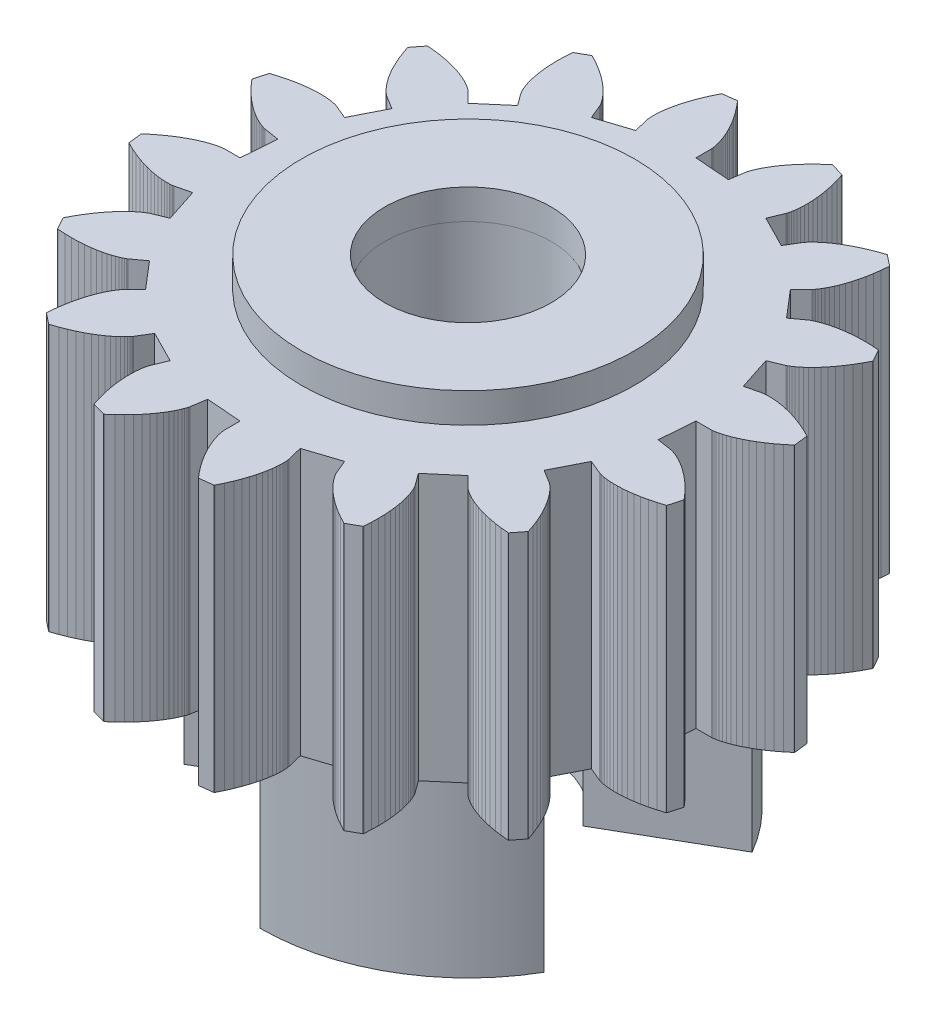
from build123d import *

# Parameters (mm, degrees)
BOSS_EXTRUDE1_DEPTH     = 8
CUT_EXTRUDE1_DEPTH      = 15.984044596
CUT_EXTRUDE1_DEPTH_BACK = 15.984044596
SKETCH2_R               = 2.525
SKETCH3_R               = 6.25
SKETCH3_R_2             = 2.525
BOSS_EXTRUDE2_DEPTH     = 5.5
SKETCH4_R               = 5
SKETCH4_R_2             = 2.5
BOSS_EXTRUDE3_DEPTH     = 0.9
CUT_EXTRUDE2_START      = -5.5
CUT_EXTRUDE2_DEPTH      = 5.5


with BuildPart() as part:
    # Sketch1 → Boss-Extrude1 (new body)
    with BuildSketch(Plane(origin=(0, 0, 0), x_dir=(1, 0, 0), z_dir=(0, 1, 0))):
        Polygon((6.85, 0), (7.309477, 1.3e-05), (7.321987, 0.000555), (7.348326, 0.002795), (7.388345, 0.007937), (7.441814, 0.017175), (7.508424, 0.03169), (7.587793, 0.052638), (7.679459, 0.081154), (7.782889, 0.118343), (7.897476, 0.165276), (8.022541, 0.222988), (8.157339, 0.29247), (8.301057, 0.37467), (8.452819, 0.470485), (8.611689, 0.580758), (8.776672, 0.706278), (8.94672, 0.847771), (8.957492, 0.857161), (8.958839, 0.858339), (8.908582, 1.279521), (8.906822, 1.280587), (8.894139, 1.28717), (8.695507, 1.384544), (8.505565, 1.467592), (8.325162, 1.537266), (8.155077, 1.594567), (7.996022, 1.640535), (7.848635, 1.676249), (7.713484, 1.702822), (7.591059, 1.721393), (7.481775, 1.733127), (7.385968, 1.739209), (7.303897, 1.740839), (7.235743, 1.739226), (7.181604, 1.735588), (7.141502, 1.731143), (7.115378, 1.727104), (7.103093, 1.724679), (6.656587, 1.616277), (6.328575, 2.621382), (6.753071, 2.797228), (6.764421, 2.802516), (6.787899, 2.814665), (6.822904, 2.83473), (6.868766, 2.863727), (6.924752, 2.902627), (6.990063, 2.952354), (7.063839, 3.013779), (7.145164, 3.087718), (7.233068, 3.174929), (7.326528, 3.276108), (7.424475, 3.391886), (7.525796, 3.522827), (7.62934, 3.669425), (7.733916, 3.832101), (7.838307, 4.011203), (7.941264, 4.207), (7.947622, 4.219797), (7.948416, 4.221401), (7.740805, 4.59129), (7.738771, 4.591601), (7.724535, 4.592829), (7.503759, 4.606779), (7.296494, 4.610817), (7.10316, 4.60615), (6.924094, 4.594), (6.759555, 4.575601), (6.609721, 4.552195), (6.474689, 4.525025), (6.354476, 4.495332), (6.249019, 4.464352), (6.158178, 4.433307), (6.081731, 4.403406), (6.019382, 4.375835), (5.970756, 4.351756), (5.935408, 4.332302), (5.912818, 4.318573), (5.902396, 4.311632), (5.531362, 4.040611), (4.843681, 4.843681), (5.168571, 5.16859), (5.177034, 5.177819), (5.194075, 5.198027), (5.218737, 5.229961), (5.250012, 5.274302), (5.28685, 5.331666), (5.328159, 5.402601), (5.372813, 5.487583), (5.419653, 5.587015), (5.467491, 5.701227), (5.515117, 5.83047), (5.561302, 5.974917), (5.604802, 6.134665), (5.644363, 6.309728), (5.678725, 6.500042), (5.70663, 6.705458), (5.726822, 6.925752), (5.727799, 6.940007), (5.727919, 6.941793), (5.394561, 7.204076), (5.392562, 7.203586), (5.37894, 7.199273), (5.169631, 7.127673), (4.976599, 7.052087), (4.799767, 6.973789), (4.638981, 6.894039), (4.494008, 6.814074), (4.364536, 6.735111), (4.25018, 6.658334), (4.150481, 6.584898), (4.064908, 6.51592), (3.992861, 6.452475), (3.933677, 6.395594), (3.886624, 6.346262), (3.850915, 6.305407), (3.825702, 6.273907), (3.810085, 6.252579), (3.803113, 6.242178), (3.564037, 5.849798), (2.621382, 6.328575), (2.797204, 6.753081), (2.80149, 6.764846), (2.809501, 6.790038), (2.820065, 6.828978), (2.831991, 6.881912), (2.844072, 6.949007), (2.855091, 7.03035), (2.863825, 7.125952), (2.869048, 7.23574), (2.869538, 7.359565), (2.864079, 7.497195), (2.851471, 7.648322), (2.830527, 7.812556), (2.800083, 7.989433), (2.759, 8.17841), (2.706171, 8.378869), (2.640523, 8.59012), (2.63597, 8.603664), (2.635398, 8.60536), (2.227044, 8.720108), (2.225385, 8.71889), (2.21445, 8.709692), (2.048474, 8.563443), (1.899061, 8.419741), (1.765653, 8.279733), (1.647625, 8.144523), (1.544288, 8.015166), (1.45489, 7.892666), (1.37862, 7.777972), (1.314613, 7.671973), (1.261951, 7.575498), (1.219668, 7.489311), (1.186755, 7.414112), (1.162163, 7.350528), (1.144806, 7.299118), (1.133567, 7.260367), (1.127301, 7.234686), (1.12484, 7.222408), (1.054121, 6.768407), (0, 6.85), (-1.3e-05, 7.309477), (-0.000555, 7.321987), (-0.002795, 7.348326), (-0.007937, 7.388345), (-0.017175, 7.441814), (-0.03169, 7.508424), (-0.052638, 7.587793), (-0.081154, 7.679459), (-0.118343, 7.782889), (-0.165276, 7.897476), (-0.222988, 8.022541), (-0.29247, 8.157339), (-0.37467, 8.301057), (-0.470485, 8.452819), (-0.580758, 8.611689), (-0.706278, 8.776672), (-0.847771, 8.94672), (-0.857161, 8.957492), (-0.858339, 8.958839), (-1.279521, 8.908582), (-1.280587, 8.906822), (-1.28717, 8.894139), (-1.384544, 8.695507), (-1.467592, 8.505565), (-1.537266, 8.325162), (-1.594567, 8.155077), (-1.640535, 7.996022), (-1.676249, 7.848635), (-1.702822, 7.713484), (-1.721393, 7.591059), (-1.733127, 7.481775), (-1.739209, 7.385968), (-1.740839, 7.303897), (-1.739226, 7.235743), (-1.735588, 7.181604), (-1.731143, 7.141502), (-1.727104, 7.115378), (-1.724679, 7.103093), (-1.616277, 6.656587), (-2.621382, 6.328575), (-2.797228, 6.753071), (-2.802516, 6.764421), (-2.814665, 6.787899), (-2.83473, 6.822904), (-2.863727, 6.868766), (-2.902627, 6.924752), (-2.952354, 6.990063), (-3.013779, 7.063839), (-3.087718, 7.145164), (-3.174929, 7.233068), (-3.276108, 7.326528), (-3.391886, 7.424475), (-3.522827, 7.525796), (-3.669425, 7.62934), (-3.832101, 7.733916), (-4.011203, 7.838307), (-4.207, 7.941264), (-4.219797, 7.947622), (-4.221401, 7.948416), (-4.59129, 7.740805), (-4.591601, 7.738771), (-4.592829, 7.724535), (-4.606779, 7.503759), (-4.610817, 7.296494), (-4.60615, 7.10316), (-4.594, 6.924094), (-4.575601, 6.759555), (-4.552195, 6.609721), (-4.525025, 6.474689), (-4.495332, 6.354476), (-4.464352, 6.249019), (-4.433307, 6.158178), (-4.403406, 6.081731), (-4.375835, 6.019382), (-4.351756, 5.970756), (-4.332302, 5.935408), (-4.318573, 5.912818), (-4.311632, 5.902396), (-4.040611, 5.531362), (-4.843681, 4.843681), (-5.16859, 5.168571), (-5.177819, 5.177034), (-5.198027, 5.194075), (-5.229961, 5.218737), (-5.274302, 5.250012), (-5.331666, 5.28685), (-5.402601, 5.328159), (-5.487583, 5.372813), (-5.587015, 5.419653), (-5.701227, 5.467491), (-5.83047, 5.515117), (-5.974917, 5.561302), (-6.134665, 5.604802), (-6.309728, 5.644363), (-6.500042, 5.678725), (-6.705458, 5.70663), (-6.925752, 5.726822), (-6.940007, 5.727799), (-6.941793, 5.727919), (-7.204076, 5.394561), (-7.203586, 5.392562), (-7.199273, 5.37894), (-7.127673, 5.169631), (-7.052087, 4.976599), (-6.973789, 4.799767), (-6.894039, 4.638981), (-6.814074, 4.494008), (-6.735111, 4.364536), (-6.658334, 4.25018), (-6.584898, 4.150481), (-6.51592, 4.064908), (-6.452475, 3.992861), (-6.395594, 3.933677), (-6.346262, 3.886624), (-6.305407, 3.850915), (-6.273907, 3.825702), (-6.252579, 3.810085), (-6.242178, 3.803113), (-5.849798, 3.564037), (-6.328575, 2.621382), (-6.753081, 2.797204), (-6.764846, 2.80149), (-6.790038, 2.809501), (-6.828978, 2.820065), (-6.881912, 2.831991), (-6.949007, 2.844072), (-7.03035, 2.855091), (-7.125952, 2.863825), (-7.23574, 2.869048), (-7.359565, 2.869538), (-7.497195, 2.864079), (-7.648322, 2.851471), (-7.812556, 2.830527), (-7.989433, 2.800083), (-8.17841, 2.759), (-8.378869, 2.706171), (-8.59012, 2.640523), (-8.603664, 2.63597), (-8.60536, 2.635398), (-8.720108, 2.227044), (-8.71889, 2.225385), (-8.709692, 2.21445), (-8.563443, 2.048474), (-8.419741, 1.899061), (-8.279733, 1.765653), (-8.144523, 1.647625), (-8.015166, 1.544288), (-7.892666, 1.45489), (-7.777972, 1.37862), (-7.671973, 1.314613), (-7.575498, 1.261951), (-7.489311, 1.219668), (-7.414112, 1.186755), (-7.350528, 1.162163), (-7.299118, 1.144806), (-7.260367, 1.133567), (-7.234686, 1.127301), (-7.222408, 1.12484), (-6.768407, 1.054121), (-6.85, 0), (-7.309477, -1.3e-05), (-7.321987, -0.000555), (-7.348326, -0.002795), (-7.388345, -0.007937), (-7.441814, -0.017175), (-7.508424, -0.03169), (-7.587793, -0.052638), (-7.679459, -0.081154), (-7.782889, -0.118343), (-7.897476, -0.165276), (-8.022541, -0.222988), (-8.157339, -0.29247), (-8.301057, -0.37467), (-8.452819, -0.470485), (-8.611689, -0.580758), (-8.776672, -0.706278), (-8.94672, -0.847771), (-8.957492, -0.857161), (-8.958839, -0.858339), (-8.908582, -1.279521), (-8.906822, -1.280587), (-8.894139, -1.28717), (-8.695507, -1.384544), (-8.505565, -1.467592), (-8.325162, -1.537266), (-8.155077, -1.594567), (-7.996022, -1.640535), (-7.848635, -1.676249), (-7.713484, -1.702822), (-7.591059, -1.721393), (-7.481775, -1.733127), (-7.385968, -1.739209), (-7.303897, -1.740839), (-7.235743, -1.739226), (-7.181604, -1.735588), (-7.141502, -1.731143), (-7.115378, -1.727104), (-7.103093, -1.724679), (-6.656587, -1.616277), (-6.328575, -2.621382), (-6.753071, -2.797228), (-6.764421, -2.802516), (-6.787899, -2.814665), (-6.822904, -2.83473), (-6.868766, -2.863727), (-6.924752, -2.902627), (-6.990063, -2.952354), (-7.063839, -3.013779), (-7.145164, -3.087718), (-7.233068, -3.174929), (-7.326528, -3.276108), (-7.424475, -3.391886), (-7.525796, -3.522827), (-7.62934, -3.669425), (-7.733916, -3.832101), (-7.838307, -4.011203), (-7.941264, -4.207), (-7.947622, -4.219797), (-7.948416, -4.221401), (-7.740805, -4.59129), (-7.738771, -4.591601), (-7.724535, -4.592829), (-7.503759, -4.606779), (-7.296494, -4.610817), (-7.10316, -4.60615), (-6.924094, -4.594), (-6.759555, -4.575601), (-6.609721, -4.552195), (-6.474689, -4.525025), (-6.354476, -4.495332), (-6.249019, -4.464352), (-6.158178, -4.433307), (-6.081731, -4.403406), (-6.019382, -4.375835), (-5.970756, -4.351756), (-5.935408, -4.332302), (-5.912818, -4.318573), (-5.902396, -4.311632), (-5.531362, -4.040611), (-4.843681, -4.843681), (-5.168571, -5.16859), (-5.177034, -5.177819), (-5.194075, -5.198027), (-5.218737, -5.229961), (-5.250012, -5.274302), (-5.28685, -5.331666), (-5.328159, -5.402601), (-5.372813, -5.487583), (-5.419653, -5.587015), (-5.467491, -5.701227), (-5.515117, -5.83047), (-5.561302, -5.974917), (-5.604802, -6.134665), (-5.644363, -6.309728), (-5.678725, -6.500042), (-5.70663, -6.705458), (-5.726822, -6.925752), (-5.727799, -6.940007), (-5.727919, -6.941793), (-5.394561, -7.204076), (-5.392562, -7.203586), (-5.37894, -7.199273), (-5.169631, -7.127673), (-4.976599, -7.052087), (-4.799767, -6.973789), (-4.638981, -6.894039), (-4.494008, -6.814074), (-4.364536, -6.735111), (-4.25018, -6.658334), (-4.150481, -6.584898), (-4.064908, -6.51592), (-3.992861, -6.452475), (-3.933677, -6.395594), (-3.886624, -6.346262), (-3.850915, -6.305407), (-3.825702, -6.273907), (-3.810085, -6.252579), (-3.803113, -6.242178), (-3.564037, -5.849798), (-2.621382, -6.328575), (-2.797204, -6.753081), (-2.80149, -6.764846), (-2.809501, -6.790038), (-2.820065, -6.828978), (-2.831991, -6.881912), (-2.844072, -6.949007), (-2.855091, -7.03035), (-2.863825, -7.125952), (-2.869048, -7.23574), (-2.869538, -7.359565), (-2.864079, -7.497195), (-2.851471, -7.648322), (-2.830527, -7.812556), (-2.800083, -7.989433), (-2.759, -8.17841), (-2.706171, -8.378869), (-2.640523, -8.59012), (-2.63597, -8.603664), (-2.635398, -8.60536), (-2.227044, -8.720108), (-2.225385, -8.71889), (-2.21445, -8.709692), (-2.048474, -8.563443), (-1.899061, -8.419741), (-1.765653, -8.279733), (-1.647625, -8.144523), (-1.544288, -8.015166), (-1.45489, -7.892666), (-1.37862, -7.777972), (-1.314613, -7.671973), (-1.261951, -7.575498), (-1.219668, -7.489311), (-1.186755, -7.414112), (-1.162163, -7.350528), (-1.144806, -7.299118), (-1.133567, -7.260367), (-1.127301, -7.234686), (-1.12484, -7.222408), (-1.054121, -6.768407), (0, -6.85), (1.3e-05, -7.309477), (0.000555, -7.321987), (0.002795, -7.348326), (0.007937, -7.388345), (0.017175, -7.441814), (0.03169, -7.508424), (0.052638, -7.587793), (0.081154, -7.679459), (0.118343, -7.782889), (0.165276, -7.897476), (0.222988, -8.022541), (0.29247, -8.157339), (0.37467, -8.301057), (0.470485, -8.452819), (0.580758, -8.611689), (0.706278, -8.776672), (0.847771, -8.94672), (0.857161, -8.957492), (0.858339, -8.958839), (1.279521, -8.908582), (1.280587, -8.906822), (1.28717, -8.894139), (1.384544, -8.695507), (1.467592, -8.505565), (1.537266, -8.325162), (1.594567, -8.155077), (1.640535, -7.996022), (1.676249, -7.848635), (1.702822, -7.713484), (1.721393, -7.591059), (1.733127, -7.481775), (1.739209, -7.385968), (1.740839, -7.303897), (1.739226, -7.235743), (1.735588, -7.181604), (1.731143, -7.141502), (1.727104, -7.115378), (1.724679, -7.103093), (1.616277, -6.656587), (2.621382, -6.328575), (2.797228, -6.753071), (2.802516, -6.764421), (2.814665, -6.787899), (2.83473, -6.822904), (2.863727, -6.868766), (2.902627, -6.924752), (2.952354, -6.990063), (3.013779, -7.063839), (3.087718, -7.145164), (3.174929, -7.233068), (3.276108, -7.326528), (3.391886, -7.424475), (3.522827, -7.525796), (3.669425, -7.62934), (3.832101, -7.733916), (4.011203, -7.838307), (4.207, -7.941264), (4.219797, -7.947622), (4.221401, -7.948416), (4.59129, -7.740805), (4.591601, -7.738771), (4.592829, -7.724535), (4.606779, -7.503759), (4.610817, -7.296494), (4.60615, -7.10316), (4.594, -6.924094), (4.575601, -6.759555), (4.552195, -6.609721), (4.525025, -6.474689), (4.495332, -6.354476), (4.464352, -6.249019), (4.433307, -6.158178), (4.403406, -6.081731), (4.375835, -6.019382), (4.351756, -5.970756), (4.332302, -5.935408), (4.318573, -5.912818), (4.311632, -5.902396), (4.040611, -5.531362), (4.843681, -4.843681), (5.16859, -5.168571), (5.177819, -5.177034), (5.198027, -5.194075), (5.229961, -5.218737), (5.274302, -5.250012), (5.331666, -5.28685), (5.402601, -5.328159), (5.487583, -5.372813), (5.587015, -5.419653), (5.701227, -5.467491), (5.83047, -5.515117), (5.974917, -5.561302), (6.134665, -5.604802), (6.309728, -5.644363), (6.500042, -5.678725), (6.705458, -5.70663), (6.925752, -5.726822), (6.940007, -5.727799), (6.941793, -5.727919), (7.204076, -5.394561), (7.203586, -5.392562), (7.199273, -5.37894), (7.127673, -5.169631), (7.052087, -4.976599), (6.973789, -4.799767), (6.894039, -4.638981), (6.814074, -4.494008), (6.735111, -4.364536), (6.658334, -4.25018), (6.584898, -4.150481), (6.51592, -4.064908), (6.452475, -3.992861), (6.395594, -3.933677), (6.346262, -3.886624), (6.305407, -3.850915), (6.273907, -3.825702), (6.252579, -3.810085), (6.242178, -3.803113), (5.849798, -3.564037), (6.328575, -2.621382), (6.753081, -2.797204), (6.764846, -2.80149), (6.790038, -2.809501), (6.828978, -2.820065), (6.881912, -2.831991), (6.949007, -2.844072), (7.03035, -2.855091), (7.125952, -2.863825), (7.23574, -2.869048), (7.359565, -2.869538), (7.497195, -2.864079), (7.648322, -2.851471), (7.812556, -2.830527), (7.989433, -2.800083), (8.17841, -2.759), (8.378869, -2.706171), (8.59012, -2.640523), (8.603664, -2.63597), (8.60536, -2.635398), (8.720108, -2.227044), (8.71889, -2.225385), (8.709692, -2.21445), (8.563443, -2.048474), (8.419741, -1.899061), (8.279733, -1.765653), (8.144523, -1.647625), (8.015166, -1.544288), (7.892666, -1.45489), (7.777972, -1.37862), (7.671973, -1.314613), (7.575498, -1.261951), (7.489311, -1.219668), (7.414112, -1.186755), (7.350528, -1.162163), (7.299118, -1.144806), (7.260367, -1.133567), (7.234686, -1.127301), (7.222408, -1.12484), (6.768407, -1.054121), align=None)
    extrude(amount=BOSS_EXTRUDE1_DEPTH)

    # Sketch2 → Cut-Extrude1 (cut, two sides: drawn at the far end of the back side and taken through both)
    with BuildSketch(Plane(origin=(0, 8, 0), x_dir=(1, 0, 0), z_dir=(0, 1, 0)).offset(-CUT_EXTRUDE1_DEPTH_BACK)):
        Circle(SKETCH2_R)
    extrude(amount=CUT_EXTRUDE1_DEPTH + CUT_EXTRUDE1_DEPTH_BACK, mode=Mode.SUBTRACT)

    # Sketch3 → Boss-Extrude2 (add)
    with BuildSketch(Plane.XZ):
        Circle(SKETCH3_R)
        Circle(SKETCH3_R_2, mode=Mode.SUBTRACT)
    extrude(amount=BOSS_EXTRUDE2_DEPTH)

    # Sketch4 → Boss-Extrude3 (add)
    with BuildSketch(Plane(origin=(0, 8, 0), x_dir=(1, 0, 0), z_dir=(0, 1, 0))):
        Circle(SKETCH4_R)
        Circle(SKETCH4_R_2, mode=Mode.SUBTRACT)
    extrude(amount=BOSS_EXTRUDE3_DEPTH)

    # Sketch5 → Cut-Extrude2 (cut)
    with BuildSketch(Plane.XZ.offset(5.5).offset(CUT_EXTRUDE2_START)):
        with BuildLine():
            Line((2.186714145, -1.2625), (5.412658774, -3.125))
            ThreePointArc((5.412658774, -3.125), (6.25, 0), (5.412658774, 3.125))
            Line((5.412658774, 3.125), (2.186714145, 1.2625))
            ThreePointArc((2.186714145, 1.2625), (2.525, 0), (2.186714145, -1.2625))
        make_face()
        with BuildLine():
            ThreePointArc((-5.412658774, -3.125), (-3.125, -5.412658774), (0, -6.25))
            Line((0, -6.25), (0, -2.525))
            ThreePointArc((0, -2.525), (-1.2625, -2.186714145), (-2.186714145, -1.2625))
            Line((-2.186714145, -1.2625), (-5.412658774, -3.125))
        make_face()
        with BuildLine():
            Line((-5.412658774, 3.125), (-2.186714145, 1.2625))
            ThreePointArc((-2.186714145, 1.2625), (-1.2625, 2.186714145), (0, 2.525))
            Line((0, 2.525), (0, 6.25))
            ThreePointArc((0, 6.25), (-3.125, 5.412658774), (-5.412658774, 3.125))
        make_face()
    extrude(amount=CUT_EXTRUDE2_DEPTH, mode=Mode.SUBTRACT)


solid = part.part
